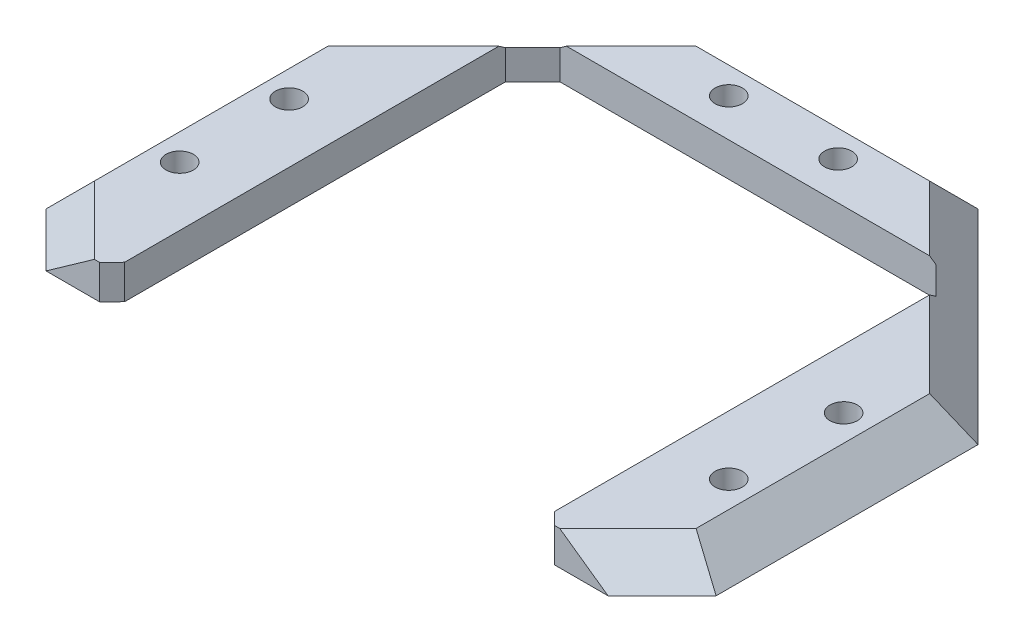
from build123d import *

# Parameters (mm, degrees)
BOSS_EXTRUDE1_DEPTH = 5
SKETCH4_R           = 2
CUT_EXTRUDE1_DEPTH  = 5
CHAMFER1_SIZE       = 5


with BuildPart() as part:
    # Sketch3 → Boss-Extrude1 (new body)
    with BuildSketch(Plane(origin=(0, 0, 0), x_dir=(1, 0, 0), z_dir=(0, 1, 0))):
        Polygon((-11.092806328, -75.233836931), (-12.882806328, -77.083836936), (-20.742806328, -77.083836936), (-28.592806328, -69.233836936), (-28.592806328, -30.933836936), (-20.742806328, -23.083836936), (-6.592793915, -8.933824523), (1.257206085, -1.083824523), (39.557206085, -1.083824523), (47.407206085, -8.933824523), (69.407218499, -30.933836936), (69.407218499, -69.233836936), (61.507218499, -77.133836936), (53.647218499, -77.133836936), (51.907218499, -75.393836936), (51.907218499, -19.55903866), (47.907218499, -15.55903866), (-7.092806328, -15.55903866), (-11.092806328, -19.55903866), align=None)
    extrude(amount=BOSS_EXTRUDE1_DEPTH)

    # Sketch4 → Cut-Extrude1 (cut)
    with BuildSketch(Plane(origin=(0, 5, 0), x_dir=(1, 0, 0), z_dir=(0, 1, 0))):
        with Locations(Location((-19.742793915, -58.533836936, 0), (0, 0, 270))):
            Circle(SKETCH4_R)
        with Locations(Location((-19.742793915, -42.533836936, 0), (0, 0, 270))):
            Circle(SKETCH4_R)
        with Locations(Location((60.557206085, -41.733836936, 0), (0, 0, 270))):
            Circle(SKETCH4_R)
        with Locations(Location((60.557206085, -58.533836936, 0), (0, 0, 270))):
            Circle(SKETCH4_R)
        with Locations(Location((12.007206085, -9.983836936, 0), (0, 0, 270))):
            Circle(SKETCH4_R)
        with Locations(Location((28.007206085, -9.983836936, 0), (0, 0, 270))):
            Circle(SKETCH4_R)
    extrude(amount=-CUT_EXTRUDE1_DEPTH, mode=Mode.SUBTRACT)

    # Chamfer1
    # the kernel refuses this chamfer: 5 mm, written as the material it takes off along each edge
    with BuildSketch(Plane(origin=(78.499490898, 5, 60.141564537), x_dir=(-0.7068394360706721, 0.027495876610586303, -0.7068394360706748), z_dir=(-0.7071067811865488, 0, 0.7071067811865462))) as chamfer1_piece_1:
        Polygon((CHAMFER1_SIZE * 0.999621916911, CHAMFER1_SIZE * 0.0274958766106), (-CHAMFER1_SIZE * 0.0274958766106, CHAMFER1_SIZE * 0.999621916911), (0, 0), align=None)
    extrude(amount=36.889117022, mode=Mode.SUBTRACT)
    with BuildSketch(Plane(origin=(-11.650533929, 5, 86.176109335), x_dir=(0.7068394360706736, 0.027495876610586337, -0.7068394360706732), z_dir=(-0.7071067811865474, 0, -0.7071067811865477))) as chamfer1_piece_2:
        Polygon((CHAMFER1_SIZE * 0.999621916911, CHAMFER1_SIZE * 0.0274958766106), (-CHAMFER1_SIZE * 0.0274958766106, CHAMFER1_SIZE * 0.999621916911), (0, 0), align=None)
    extrude(amount=36.818406344, mode=Mode.SUBTRACT)
    with BuildSketch(Plane(origin=(-28.592806328, 5, 82.092251876), x_dir=(0.9996219169112968, 0.027495876610586317, 0), z_dir=(0, 0, -1)), Plane(origin=(-11.601208855, 5, 1.083824523), x_dir=(3.4424184920964096e-15, 0.027495876610586317, 0.9996219169112968), z_dir=(1, 0, 0)), Plane(origin=(69.407218499, 5, 18.075421996), x_dir=(-0.9996219169112968, 0.027495876610586282, 0), z_dir=(0, 0, 1))) as chamfer1_piece_3:
        Polygon((CHAMFER1_SIZE * 0.999621916911, CHAMFER1_SIZE * 0.0274958766106), (-CHAMFER1_SIZE * 0.0274958766106, CHAMFER1_SIZE * 0.999621916911), (0, 0), align=None)
    extrude(amount=64.01682988, mode=Mode.SUBTRACT)
    with BuildSketch(Plane(origin=(-37.685078728, 5, 40.026109335), x_dir=(0.7068394360706731, 0.027495876610586303, 0.7068394360706738), z_dir=(0.7071067811865479, 0, -0.7071067811865474)), Plane(origin=(30.464933686, 5, -8.008447877), x_dir=(-0.7068394360706771, 0.027495876610586313, 0.70683943607067), z_dir=(0.707106781186544, 0, 0.707106781186551))) as chamfer1_piece_4:
        Polygon((CHAMFER1_SIZE * 0.999621916911, CHAMFER1_SIZE * 0.0274958766106), (-CHAMFER1_SIZE * 0.0274958766106, CHAMFER1_SIZE * 0.999621916911), (0, 0), align=None)
    extrude(amount=67.931122272, mode=Mode.SUBTRACT)


solid = part.part
